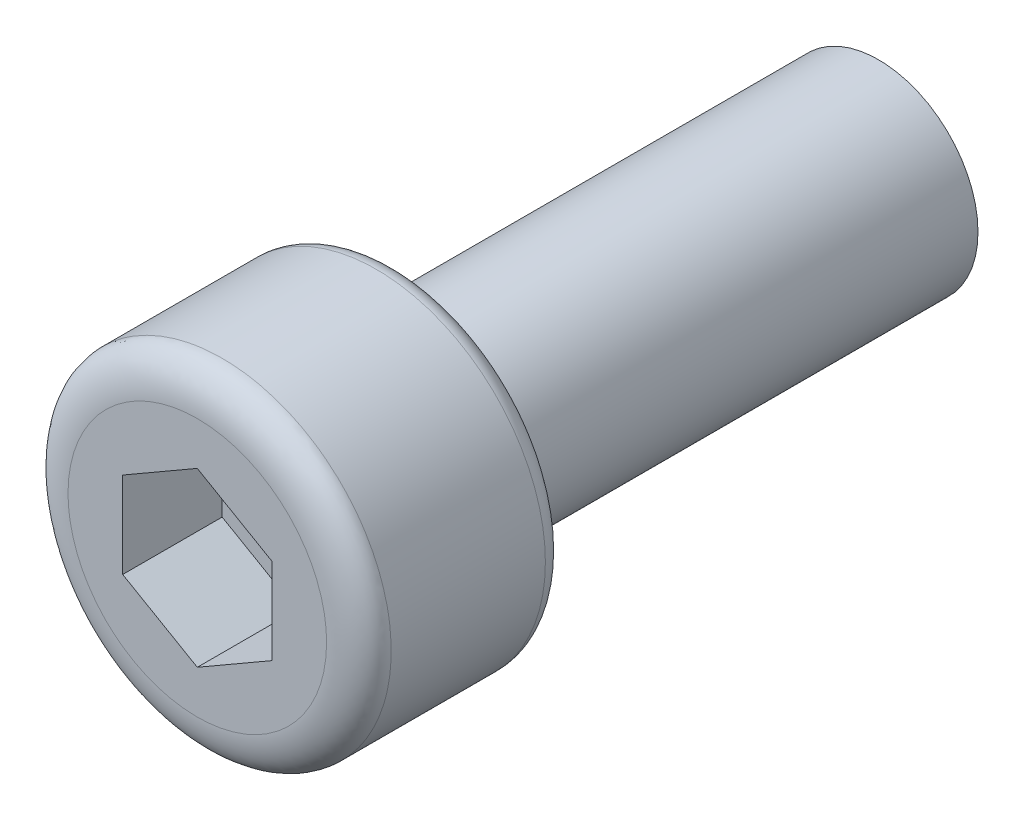
from build123d import *

# Parameters (mm, degrees)
CHAMFER_1_SIZE      = 0.3
CHAMFER_1_SIZE2     = 0.519615242
FILLET_1_R          = 0.4
FILLET_2_SIZE       = 0.5
FILLET_2_SIZE_2     = 0.8
CUT_EXTRUDE_1_DEPTH = 2


with BuildPart() as part:
    # 草图2 → 旋转1 (revolve)
    with BuildSketch(Plane(origin=(0, 0, 0), x_dir=(0, 0, -1), z_dir=(1, 0, 0)), mode=Mode.PRIVATE) as revolve_1_sk:
        Polygon((-7, 0), (-7, 3.4), (-3, 3.4), (-3, 2), (7, 2), (7, 0), align=None)
    revolve(revolve_1_sk.sketch.rotate(Axis((0, 0, -7), (0, 0, 1)), 90), axis=Axis((0, 0, -7), (0, 0, 1)))

    # 倒角1
    chamfer_1_edges = [part.edges().sort_by_distance(p)[0] for p in [
        (2, 0, -7),
    ]]
    chamfer_1_side = [part.faces().sort_by_distance(p)[0] for p in [
        (2, 0, -2),
    ]]
    chamfer(chamfer_1_edges, length=CHAMFER_1_SIZE, length2=CHAMFER_1_SIZE2, reference=chamfer_1_side[0])

    # 圆角1
    fillet_1_edges = [part.edges().sort_by_distance(p)[0] for p in [
        (3.4, 0, 3),
    ]]
    fillet(fillet_1_edges, radius=FILLET_1_R)

    # 圆角2
    # an asymmetric fillet: 0.8, 0.5 mm, written as the material it takes off along each edge
    with BuildSketch(Plane(origin=(0, 0, 7), x_dir=(-1, 0, 0), z_dir=(0, 1, 0))) as fillet_2_piece_1:
        with BuildLine():
            Bezier((3.4, -FILLET_2_SIZE), (3.4, 0), (3.4 - FILLET_2_SIZE_2, 0), weights=[1, 0.707106781, 1])
            Line((3.4 - FILLET_2_SIZE_2, 0), (3.4, 0))
            Line((3.4, 0), (3.4, -FILLET_2_SIZE))
        make_face()
    revolve(axis=Axis((0, 0, 7), (0, 0, 1)), mode=Mode.SUBTRACT)

    # 草图3 → 切除-拉伸1 (cut)
    with BuildSketch(Plane.XY.offset(7)):
        Polygon((0, 1.732050808), (-1.5, 0.866025404), (-1.5, -0.866025404), (0, -1.732050808), (1.5, -0.866025404), (1.5, 0.866025404), align=None)
    extrude(amount=-CUT_EXTRUDE_1_DEPTH, mode=Mode.SUBTRACT)


solid = part.part
